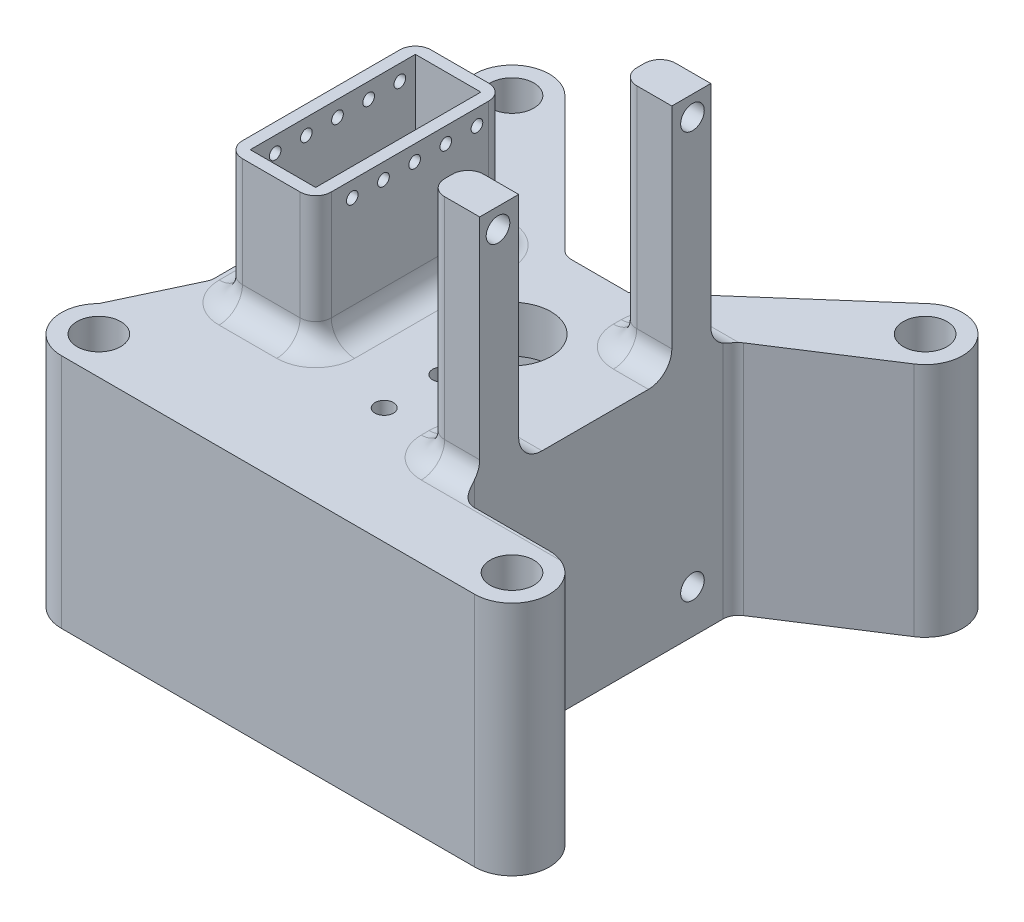
from build123d import *
from build123d.topology import SkipClean

# Parameters (mm, degrees)
SKETCH3_R           = 3.556
BOSS_EXTRUDE1_DEPTH = 21.463
SKETCH4_R           = 3.556
BOSS_EXTRUDE2_DEPTH = 7.366
SKETCH5_R           = 3.556
SKETCH5_R_2         = 6.35
BOSS_EXTRUDE3_DEPTH = 7.62
SKETCH6_W           = 14.478
SKETCH6_H           = 30.734
BOSS_EXTRUDE4_DEPTH = 21.59
SKETCH7_W           = 10.668
SKETCH7_H           = 26.924
CUT_EXTRUDE1_DEPTH  = 50.8
SKETCH8_R           = 0.9525
CUT_EXTRUDE2_DEPTH  = 98.47261558
SKETCH10_W          = 8.255
SKETCH10_H          = 6.35
BOSS_EXTRUDE5_DEPTH = 38.1
SKETCH9_R           = 1.92499996
CUT_EXTRUDE3_DEPTH  = 5.74999993
SKETCH13_R          = 1.500000048
CUT_EXTRUDE4_DEPTH  = 4.000000128
FILLET1_R           = 2.54
FILLET2_R           = 3.81
BOSS_EXTRUDE6_START = 2.058500074
SKETCH14_R          = 3.556
BOSS_EXTRUDE6_DEPTH = 2.058500074


with BuildPart() as part:
    # Sketch3 → Boss-Extrude1 (new body)
    with BuildSketch(Plane(origin=(0, 0, 0), x_dir=(1, 0, 0), z_dir=(0, 1, 0))):
        with BuildLine():
            Line((-33.675960454, -39.771960454), (33.675960454, -39.771960454))
            ThreePointArc((33.675960454, -39.771960454), (39.771960454, -33.675960454), (33.675960454, -27.579960454))
            Line((33.675960454, -27.579960454), (18.923, -27.579960454))
            Line((18.923, -27.579960454), (18.923, 16.870039546))
            Line((18.923, 16.870039546), (36.987426386, 28.557815343))
            ThreePointArc((36.987426386, 28.557815343), (38.539435093, 37.351260501), (29.656332864, 38.25895184))
            Line((29.656332864, 38.25895184), (3.556, 15.367))
            Line((3.556, 15.367), (3.556, 10.033))
            Line((3.556, 10.033), (10.033, 10.033))
            Line((10.033, 10.033), (10.033, -30.099))
            Line((10.033, -30.099), (-10.033, -30.099))
            Line((-10.033, -30.099), (-10.033, 10.033))
            Line((-10.033, 10.033), (-3.556, 10.033))
            Line((-3.556, 10.033), (-3.556, 15.367))
            Line((-3.556, 15.367), (-6.731, 15.367))
            Line((-6.731, 15.367), (-29.366862115, 37.987907521))
            ThreePointArc((-29.366862115, 37.987907521), (-36.009729137, 39.307544577), (-39.771960454, 33.675960454))
            ThreePointArc((-39.771960454, 33.675960454), (-39.691421033, 32.688311717), (-39.451930917, 31.726760309))
            Line((-39.451930917, 31.726760309), (-32.131, 10.033))
            Line((-32.131, 10.033), (-32.131, -16.891))
            Line((-32.131, -16.891), (-37.986483392, -29.365437516))
            ThreePointArc((-37.986483392, -29.365437516), (-39.307930084, -31.34312225), (-39.771960454, -33.675960454))
            ThreePointArc((-39.771960454, -33.675960454), (-37.986483392, -37.986483392), (-33.675960454, -39.771960454))
        make_face()
        with Locations((-33.675960454, 33.675960454)):
            Circle(SKETCH3_R, mode=Mode.SUBTRACT)
        with Locations((33.675960454, 33.675960454)):
            Circle(SKETCH3_R, mode=Mode.SUBTRACT)
        with Locations((33.675960454, -33.675960454)):
            Circle(SKETCH3_R, mode=Mode.SUBTRACT)
        with Locations((-33.675960454, -33.675960454)):
            Circle(SKETCH3_R, mode=Mode.SUBTRACT)
    extrude(amount=BOSS_EXTRUDE1_DEPTH)

    # Sketch4 → Boss-Extrude2 (add)
    with BuildSketch(Plane(origin=(0, 21.463, 0), x_dir=(1, 0, 0), z_dir=(0, 1, 0))):
        with BuildLine():
            Line((3.556, 15.367), (-3.556, 15.367))
            Line((-3.556, 15.367), (-6.731, 15.367))
            Line((-6.731, 15.367), (-29.366862115, 37.987907521))
            ThreePointArc((-29.366862115, 37.987907521), (-36.891301736, 38.855033386), (-39.451930917, 31.726760309))
            Line((-39.451930917, 31.726760309), (-32.131, 10.033))
            Line((-32.131, 10.033), (-32.131, -16.891))
            Line((-32.131, -16.891), (-37.986483392, -29.365437516))
            ThreePointArc((-37.986483392, -29.365437516), (-39.307930084, -36.008798658), (-33.675960454, -39.771960454))
            Line((-33.675960454, -39.771960454), (33.675960454, -39.771960454))
            ThreePointArc((33.675960454, -39.771960454), (39.771960454, -33.675960454), (33.675960454, -27.579960454))
            Line((33.675960454, -27.579960454), (18.923, -27.579960454))
            Line((18.923, -27.579960454), (18.923, 16.870039546))
            Line((18.923, 16.870039546), (36.987426386, 28.557815343))
            ThreePointArc((36.987426386, 28.557815343), (38.539435093, 37.351260501), (29.656332864, 38.25895184))
            Line((29.656332864, 38.25895184), (3.556, 15.367))
        make_face()
        with Locations((33.675960454, -33.675960454)):
            Circle(SKETCH4_R, mode=Mode.SUBTRACT)
        with Locations((33.675960454, 33.675960454)):
            Circle(SKETCH4_R, mode=Mode.SUBTRACT)
        with Locations((-33.675960454, 33.675960454)):
            Circle(SKETCH4_R, mode=Mode.SUBTRACT)
        with Locations((-33.675960454, -33.675960454)):
            Circle(SKETCH4_R, mode=Mode.SUBTRACT)
        Polygon((-3.556, 10.033), (3.556, 10.033), (10.033, 10.033), (10.033, -30.099), (-10.033, -30.099), (-10.033, 10.033), align=None, mode=Mode.SUBTRACT)
    extrude(amount=BOSS_EXTRUDE2_DEPTH)

    # Sketch5 → Boss-Extrude3 (add)
    with BuildSketch(Plane(origin=(0, 28.829, 0), x_dir=(1, 0, 0), z_dir=(0, 1, 0))):
        with BuildLine():
            Line((3.556, 15.367), (-6.731, 15.367))
            Line((-6.731, 15.367), (-29.366862115, 37.987907521))
            ThreePointArc((-29.366862115, 37.987907521), (-36.891301736, 38.855033386), (-39.451930917, 31.726760309))
            Line((-39.451930917, 31.726760309), (-32.131, 10.033))
            Line((-32.131, 10.033), (-32.131, -16.891))
            Line((-32.131, -16.891), (-37.986483392, -29.365437516))
            ThreePointArc((-37.986483392, -29.365437516), (-39.307930084, -36.008798658), (-33.675960454, -39.771960454))
            Line((-33.675960454, -39.771960454), (33.675960454, -39.771960454))
            ThreePointArc((33.675960454, -39.771960454), (39.771960454, -33.675960454), (33.675960454, -27.579960454))
            Line((33.675960454, -27.579960454), (18.923, -27.579960454))
            Line((18.923, -27.579960454), (18.923, 16.870039546))
            Line((18.923, 16.870039546), (36.987426386, 28.557815343))
            ThreePointArc((36.987426386, 28.557815343), (38.539435093, 37.351260501), (29.656332864, 38.25895184))
            Line((29.656332864, 38.25895184), (3.556, 15.367))
        make_face()
        with Locations((33.675960454, 33.675960454)):
            Circle(SKETCH5_R, mode=Mode.SUBTRACT)
        with Locations((-33.675960454, 33.675960454)):
            Circle(SKETCH5_R, mode=Mode.SUBTRACT)
        with Locations((-33.675960454, -33.675960454)):
            Circle(SKETCH5_R, mode=Mode.SUBTRACT)
        with Locations((33.675960454, -33.675960454)):
            Circle(SKETCH5_R, mode=Mode.SUBTRACT)
        Circle(SKETCH5_R_2, mode=Mode.SUBTRACT)
    extrude(amount=BOSS_EXTRUDE3_DEPTH)

    # Sketch6 → Boss-Extrude4 (add)
    with BuildSketch(Plane(origin=(0, 36.449, 0), x_dir=(1, 0, 0), z_dir=(0, 1, 0))):
        with Locations((-20.447, -3.429)):
            Rectangle(SKETCH6_W, SKETCH6_H)
    extrude(amount=BOSS_EXTRUDE4_DEPTH)

    # Sketch7 → Cut-Extrude1 (cut)
    with BuildSketch(Plane(origin=(0, 58.039, 0), x_dir=(1, 0, 0), z_dir=(0, 1, 0))):
        with Locations((-20.447, -3.429)):
            Rectangle(SKETCH7_W, SKETCH7_H)
    extrude(amount=-CUT_EXTRUDE1_DEPTH, mode=Mode.SUBTRACT)

    # Sketch8 → Cut-Extrude2 (cut, through all)
    with BuildSketch(Plane.ZY.offset(27.686)):
        with Locations((-7.493, 55.499)):
            Circle(SKETCH8_R)
        with Locations((-2.413, 55.499)):
            Circle(SKETCH8_R)
        with Locations((2.667, 55.499)):
            Circle(SKETCH8_R)
        with Locations((7.747, 55.499)):
            Circle(SKETCH8_R)
        with Locations((12.827, 55.499)):
            Circle(SKETCH8_R)
    extrude(amount=-CUT_EXTRUDE2_DEPTH, mode=Mode.SUBTRACT)

    # Sketch10 → Boss-Extrude5 (add)
    with BuildSketch(Plane(origin=(0, 36.449, 0), x_dir=(1, 0, 0), z_dir=(0, 1, 0))):
        with Locations((14.7955, -21.014960454)):
            Rectangle(SKETCH10_W, SKETCH10_H)
        with Locations((14.7955, 10.305039546)):
            Rectangle(SKETCH10_W, SKETCH10_H)
    extrude(amount=BOSS_EXTRUDE5_DEPTH)

    # Sketch9 → Cut-Extrude3 (cut)
    with BuildSketch(Plane(origin=(18.923, 0, 0), x_dir=(0, 0, -1), z_dir=(1, 0, 0))):
        with Locations((-21.204960454, 71.3)):
            Circle(SKETCH9_R)
        with Locations((10.495039546, 71.3)):
            Circle(SKETCH9_R)
        with Locations((10.495039546, 5)):
            Circle(SKETCH9_R)
        with Locations((-21.204960454, 5)):
            Circle(SKETCH9_R)
    extrude(amount=-CUT_EXTRUDE3_DEPTH, mode=Mode.SUBTRACT)

    # Sketch13 → Cut-Extrude4 (cut)
    with BuildSketch(Plane(origin=(0, 36.449, 0), x_dir=(1, 0, 0), z_dir=(0, 1, 0))):
        with Locations((0, -11.43)):
            Circle(SKETCH13_R)
        with Locations((0, -20.828)):
            Circle(SKETCH13_R)
    extrude(amount=-CUT_EXTRUDE4_DEPTH, mode=Mode.SUBTRACT)

    # Fillet1
    fillet1_edges = [part.edges().sort_by_distance(p)[0] for p in [
        (10.668, 55.499, 17.839960454),
        (10.668, 55.499, 24.189960454),
        (10.668, 55.499, -7.130039546),
        (10.668, 55.499, -13.480039546),
        (-27.686, 47.244, -11.938),
        (-13.208, 47.244, -11.938),
        (-13.208, 47.244, 18.796),
        (-27.686, 47.244, 18.796),
        (-32.131, 18.2245, 16.891),
        (-32.131, 18.2245, -10.033),
        (-6.731, 18.2245, -15.367),
        (18.923, 18.2245, -16.870039546),
        (18.923, 18.2245, 27.579960454),
    ]]
    fillet(fillet1_edges, radius=FILLET1_R)

    # Fillet2
    fillet2_edges = [part.edges().sort_by_distance(p)[0] for p in [
        (-13.951948776, 36.449, -11.194051224),
        (-13.208, 36.449, 3.429),
        (-13.951948776, 36.449, 18.052051224),
        (-20.447, 36.449, 18.796),
        (-26.942051224, 36.449, 18.052051224),
        (-27.686, 36.449, 3.429),
        (-26.942051224, 36.449, -11.194051224),
        (16.0655, 36.449, 24.189960454),
        (11.411948776, 36.449, 23.446011678),
        (10.668, 36.449, 21.014960454),
        (11.411948776, 36.449, 18.58390923),
        (16.0655, 36.449, -7.130039546),
        (11.411948776, 36.449, -7.873988322),
        (10.668, 36.449, -10.305039546),
        (11.411948776, 36.449, -12.73609077),
        (-20.447, 36.449, -11.938),
        (16.0655, 36.449, 17.839960454),
        (16.0655, 36.449, -13.480039546),
    ]]
    fillet(fillet2_edges, radius=FILLET2_R)

    # Sketch14 → Boss-Extrude6 (add)
    with SkipClean():  # the faces are left unmerged after this step: merging them gives an invalid solid
        with BuildSketch(Plane.XZ.offset(BOSS_EXTRUDE6_START)):
            with BuildLine():
                Line((-3.556, -10.033), (-10.033, -10.033))
                Line((-10.033, -10.033), (-10.033, 30.099))
                Line((-10.033, 30.099), (10.033, 30.099))
                Line((10.033, 30.099), (10.033, -10.033))
                Line((10.033, -10.033), (3.556, -10.033))
                Line((3.556, -10.033), (3.556, -15.367))
                Line((3.556, -15.367), (29.656332864, -38.25895184))
                ThreePointArc((29.656332864, -38.25895184), (38.539435093, -37.351260501), (36.987426386, -28.557815343))
                Line((36.987426386, -28.557815343), (20.083222528, -17.620709426))
                ThreePointArc((20.083222528, -17.620709426), (19.231830489, -16.702019883), (18.923, -15.488148963))
                Line((18.923, -15.488148963), (18.923, 25.039960454))
                ThreePointArc((18.923, 25.039960454), (19.666948776, 26.836011678), (21.463, 27.579960454))
                Line((21.463, 27.579960454), (33.675960454, 27.579960454))
                ThreePointArc((33.675960454, 27.579960454), (39.771960454, 33.675960454), (33.675960454, 39.771960454))
                Line((33.675960454, 39.771960454), (-33.675960454, 39.771960454))
                ThreePointArc((-33.675960454, 39.771960454), (-39.307930084, 36.008798658), (-37.986483392, 29.365437516))
                Line((-37.986483392, 29.365437516), (-32.371707745, 17.403800315))
                ThreePointArc((-32.371707745, 17.403800315), (-32.191907189, 16.877416157), (-32.131, 16.324515771))
                Line((-32.131, 16.324515771), (-32.131, -9.615969956))
                ThreePointArc((-32.131, -9.615969956), (-32.164558092, -10.027490263), (-32.26434564, -10.428136683))
                Line((-32.26434564, -10.428136683), (-39.451930917, -31.726760309))
                ThreePointArc((-39.451930917, -31.726760309), (-36.891301736, -38.855033386), (-29.366862115, -37.987907521))
                Line((-29.366862115, -37.987907521), (-7.474846818, -16.110355389))
                ThreePointArc((-7.474846818, -16.110355389), (-6.651017369, -15.560185424), (-5.679389177, -15.367))
                Line((-5.679389177, -15.367), (-3.556, -15.367))
                Line((-3.556, -15.367), (-3.556, -10.033))
            make_face()
            with Locations((-33.675960454, -33.675960454)):
                Circle(SKETCH14_R, mode=Mode.SUBTRACT)
            with Locations((-33.675960454, 33.675960454)):
                Circle(SKETCH14_R, mode=Mode.SUBTRACT)
            with Locations((33.675960454, 33.675960454)):
                Circle(SKETCH14_R, mode=Mode.SUBTRACT)
            with Locations((33.675960454, -33.675960454)):
                Circle(SKETCH14_R, mode=Mode.SUBTRACT)
        extrude(amount=-BOSS_EXTRUDE6_DEPTH)


solid = part.part
